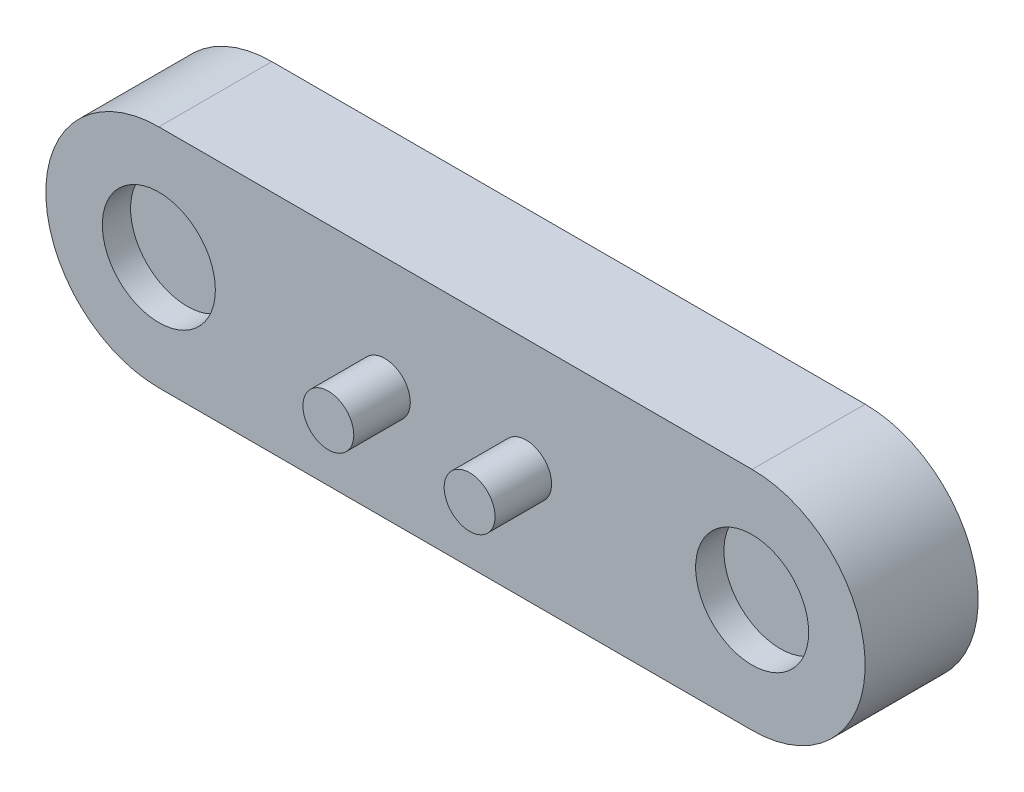
from build123d import *

# Parameters (mm, degrees)
BASE_FLANGE1_DEPTH  = 2
SKETCH6_R           = 1
CUT_EXTRUDE1_DEPTH  = 0.5
SKETCH8_R           = 0.45
BOSS_EXTRUDE1_DEPTH = 1


# Sheet-metal steps are written as plain solids
with BuildPart() as part:
    # Sketch1 → Base-Flange1 (new body)
    with BuildSketch(Plane.XY):
        with BuildLine():
            Line((10.5, -2), (0, -2))
            ThreePointArc((0, -2), (-2, 0), (0, 2))
            Line((0, 2), (10.5, 2))
            ThreePointArc((10.5, 2), (12.5, 0), (10.5, -2))
        make_face()
    extrude(amount=-BASE_FLANGE1_DEPTH)

    # Sketch6 → Cut-Extrude1 (cut)
    with BuildSketch(Plane.XY):
        Circle(SKETCH6_R)
        with Locations((10.5, 0)):
            Circle(SKETCH6_R)
    extrude(amount=-CUT_EXTRUDE1_DEPTH, mode=Mode.SUBTRACT)

    # Sketch8 → Boss-Extrude1 (add)
    with BuildSketch(Plane.XY):
        with Locations((4, 0)):
            Circle(SKETCH8_R)
        with Locations((6.5, 0)):
            Circle(SKETCH8_R)
    extrude(amount=BOSS_EXTRUDE1_DEPTH)


solid = part.part
